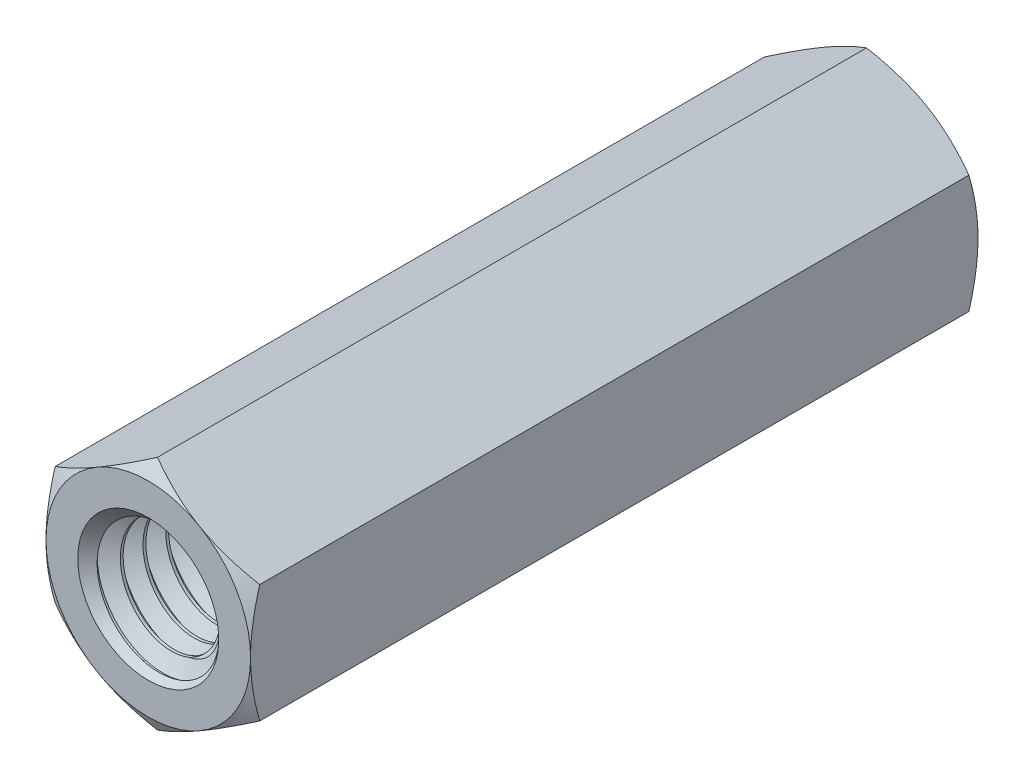
from build123d import *

# Parameters (mm, degrees)
EXTRUDE1_DEPTH          = 8
EXTRUDE1_DEPTH_BACK     = 8
SKETCH1_R               = 1.5
SWEEP1_PITCH            = 0.5
EXTRUDE2_DEPTH          = 17.854323483
SKETCH8_OUTSIDE_W       = 71.924
SKETCH8_OUTSIDE_H       = 72.62
SKETCH8_OUTSIDE_R       = 2.25
EXTRUDE4_DEPTH          = 17.854323483
EXTRUDE4_DRAFT          = -60
MIRROR1_COPY_1_SKETCH_W = 71.924
MIRROR1_COPY_1_SKETCH_H = 72.62
MIRROR1_COPY_1_SKETCH_R = 2.25
MIRROR1_COPY_1_DEPTH    = 17.854323483
MIRROR1_COPY_1_DRAFT    = -60


with BuildPart() as part:
    # Sketch1 → Extrude1 (new, two sides: drawn at the far end of the back side and taken through both)
    with BuildSketch(Plane.XY.offset(-EXTRUDE1_DEPTH_BACK)):
        Polygon((0, 2.598076211), (-2.25, 1.299038106), (-2.25, -1.299038106), (0, -2.598076211), (2.25, -1.299038106), (2.25, 1.299038106), align=None)
        Circle(SKETCH1_R, mode=Mode.SUBTRACT)
    extrude(amount=EXTRUDE1_DEPTH + EXTRUDE1_DEPTH_BACK)

    # Sweep1: the profile of Sketch12 profile screwed along a right-hand helix of 33 turns, 6 arcs to a turn; built about Z, then put on its axis
    sweep1_z = Axis((0, 0, 0), (0, 0, 1))
    sweep1_corners = [(1.5003, 0, -0.437673205), (1.5003, 0, 0.000173205), (1.175240474, 0, -0.1875), (1.175240474, 0, -0.25)]
    with BuildLine(mode=Mode.PRIVATE) as sweep1_profile:
        Line(sweep1_corners[0], sweep1_corners[1])
        Line(sweep1_corners[1], sweep1_corners[2])
        Line(sweep1_corners[2], sweep1_corners[3])
        Line(sweep1_corners[3], sweep1_corners[0])
    sweep1_cap = Face(sweep1_profile.wire())
    sweep1_turn_angles = [0, 30, 60, 90, 120, 150, 180, 210, 240, 270, 300, 330, 360]
    sweep1_turn_weights = [1, 0.8660254037844387, 1, 0.8660254037844387, 1, 0.8660254037844387, 1, 0.8660254037844387, 1, 0.8660254037844387, 1, 0.8660254037844387, 1]
    sweep1_turn_rails = [Edge.make_bspline([Vector(p[0], p[1], 0).rotate(sweep1_z, sweep1_turn_angles[k]) / sweep1_turn_weights[k] + Vector(0, 0, p[2] + SWEEP1_PITCH * sweep1_turn_angles[k] / 360) for k in range(13)], [0, 0, 0, 1, 1, 2, 2, 3, 3, 4, 4, 5, 5, 6, 6, 6], 2, sweep1_turn_weights) for p in sweep1_corners]
    sweep1_turn_sides = [Face.make_surface_from_curves(sweep1_turn_rails[p[0]], sweep1_turn_rails[p[1]]) for p in [(0, 1), (1, 2), (2, 3), (3, 0)]]
    sweep1 = Plane(origin=(0, 0, -8), x_dir=(0, 1, 0), z_dir=(0, 0, 1)) * Solid(Shell([*[p.moved(Location((0, 0, SWEEP1_PITCH * i))) for i in range(33) for p in sweep1_turn_sides], sweep1_cap, sweep1_cap.rotate(sweep1_z, 11880).moved(Location((0, 0, SWEEP1_PITCH * 11880 / 360)))]))
    add(sweep1)

    # Sketch6 → Extrude2 (cut, through all)
    with BuildSketch(Plane(origin=(0, 0, -8), x_dir=(-1, 0, 0), z_dir=(0, 0, -1))):
        Polygon((0, 2.598076211), (-2.25, 1.299038106), (-2.25, -1.299038106), (0, -2.598076211), (2.25, -1.299038106), (2.25, 1.299038106), align=None)
    extrude2 = extrude(amount=EXTRUDE2_DEPTH, mode=Mode.SUBTRACT)

    # Extrude3 cone 1 section (through the dimple's axis) → Extrude3 (revolve, cut)
    with BuildSketch(Plane(origin=(0, 0, -8), x_dir=(0, 1, 0), z_dir=(1, 0, 0))):
        Polygon((0, 0), (1.5508, 0), (0, 1.663029396), align=None)
    extrude3 = revolve(axis=Axis((0, 0, -8), (0, 0, 1)), mode=Mode.SUBTRACT)


with BuildPart() as extrude4_tool:
    # Sketch8 outside → Extrude4 (with draft: the straight prism first)
    with BuildSketch(Plane(origin=(0, 0, -8), x_dir=(-1, 0, 0), z_dir=(0, 0, -1))):
        Rectangle(SKETCH8_OUTSIDE_W, SKETCH8_OUTSIDE_H)
        Circle(SKETCH8_OUTSIDE_R, mode=Mode.SUBTRACT)
    extrude(amount=-EXTRUDE4_DEPTH)
    # Extrude4: the draft: its side faces are tilted about the plane it starts from
    extrude4_sides = [extrude4_tool.faces().sort_by_distance(p)[0] for p in [
        (0, -36.31, 0.927161741),
        (-35.962, 0, 0.927161741),
        (0, 36.31, 0.927161741),
        (35.962, 0, 0.927161741),
        (2.25, 0, 0.927161741),
    ]]
    draft(extrude4_sides, Plane(origin=(0, 0, -8), x_dir=(-1, 0, 0), z_dir=(0, 0, -1)), EXTRUDE4_DRAFT)


with BuildPart() as part_1:
    add(part.part)

    # Extrude4: cut by extrude4_tool
    add(extrude4_tool.part, mode=Mode.SUBTRACT)

    # Mirror1: Extrude2, Extrude3 across plane
    add(extrude2.mirror(Plane.XY), mode=Mode.SUBTRACT)
    add(extrude3.mirror(Plane.XY), mode=Mode.SUBTRACT)


with BuildPart() as mirror1_copy_1_tool:
    # Mirror1 copy 1 sketch → Mirror1 copy 1 (with draft: the straight prism first)
    with BuildSketch(Plane(origin=(0, 0, 8), x_dir=(-1, 0, 0), z_dir=(0, 0, 1))):
        Rectangle(MIRROR1_COPY_1_SKETCH_W, MIRROR1_COPY_1_SKETCH_H)
        Circle(MIRROR1_COPY_1_SKETCH_R, mode=Mode.SUBTRACT)
    extrude(amount=-MIRROR1_COPY_1_DEPTH)
    # Mirror1 copy 1: the draft: its side faces are tilted about the plane it starts from
    mirror1_copy_1_sides = [mirror1_copy_1_tool.faces().sort_by_distance(p)[0] for p in [
        (0, -36.31, -0.927161741),
        (-35.962, 0, -0.927161741),
        (0, 36.31, -0.927161741),
        (35.962, 0, -0.927161741),
        (2.25, 0, -0.927161741),
    ]]
    draft(mirror1_copy_1_sides, Plane(origin=(0, 0, 8), x_dir=(-1, 0, 0), z_dir=(0, 0, 1)), MIRROR1_COPY_1_DRAFT)


with BuildPart() as part_2:
    add(part_1.part)

    # Mirror1 copy 1: cut by mirror1_copy_1_tool
    add(mirror1_copy_1_tool.part, mode=Mode.SUBTRACT)


solid = part_2.part
